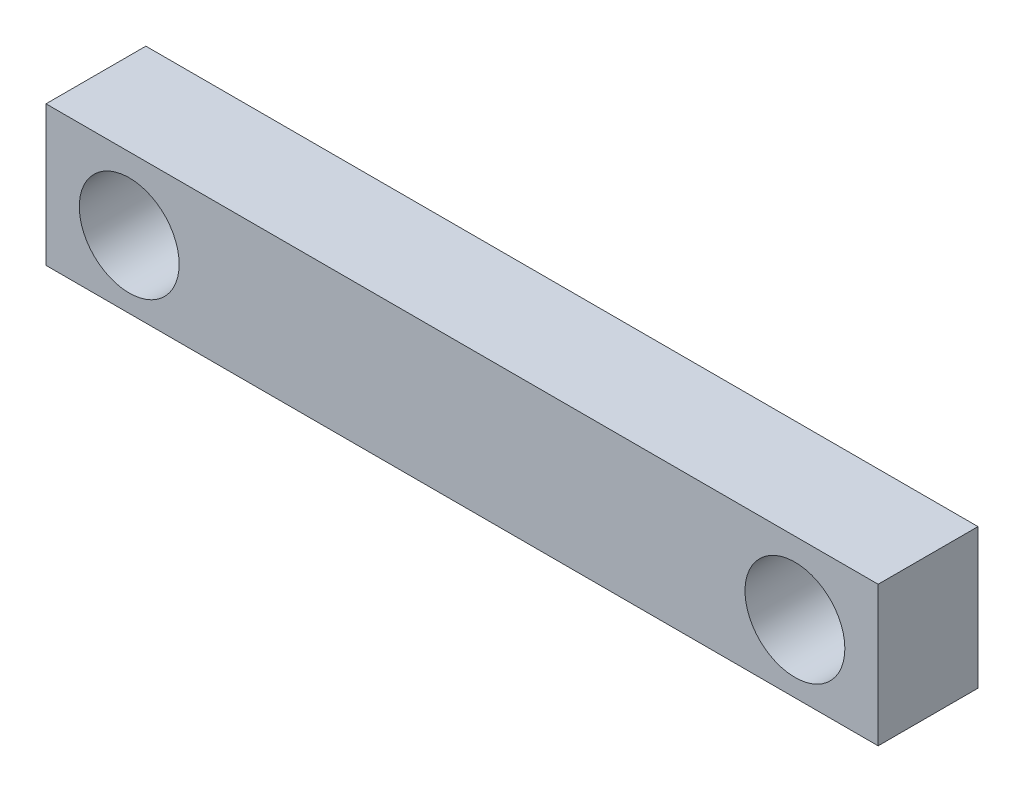
from build123d import *

# Parameters (mm, degrees)
SKETCH1_W           = 1250
SKETCH1_H           = 210.257392811
BOSS_EXTRUDE1_DEPTH = 150
SKETCH2_R           = 75
CUT_EXTRUDE1_DEPTH  = 150


with BuildPart() as part:
    # Sketch1 → Boss-Extrude1 (new body)
    with BuildSketch(Plane.XY):
        with Locations((500, 3.571821645)):
            Rectangle(SKETCH1_W, SKETCH1_H)
    extrude(amount=BOSS_EXTRUDE1_DEPTH)

    # Sketch2 → Cut-Extrude1 (cut)
    with BuildSketch(Plane.XY.offset(150)):
        Circle(SKETCH2_R)
        with Locations((1000, 0)):
            Circle(SKETCH2_R)
    extrude(amount=-CUT_EXTRUDE1_DEPTH, mode=Mode.SUBTRACT)


solid = part.part
